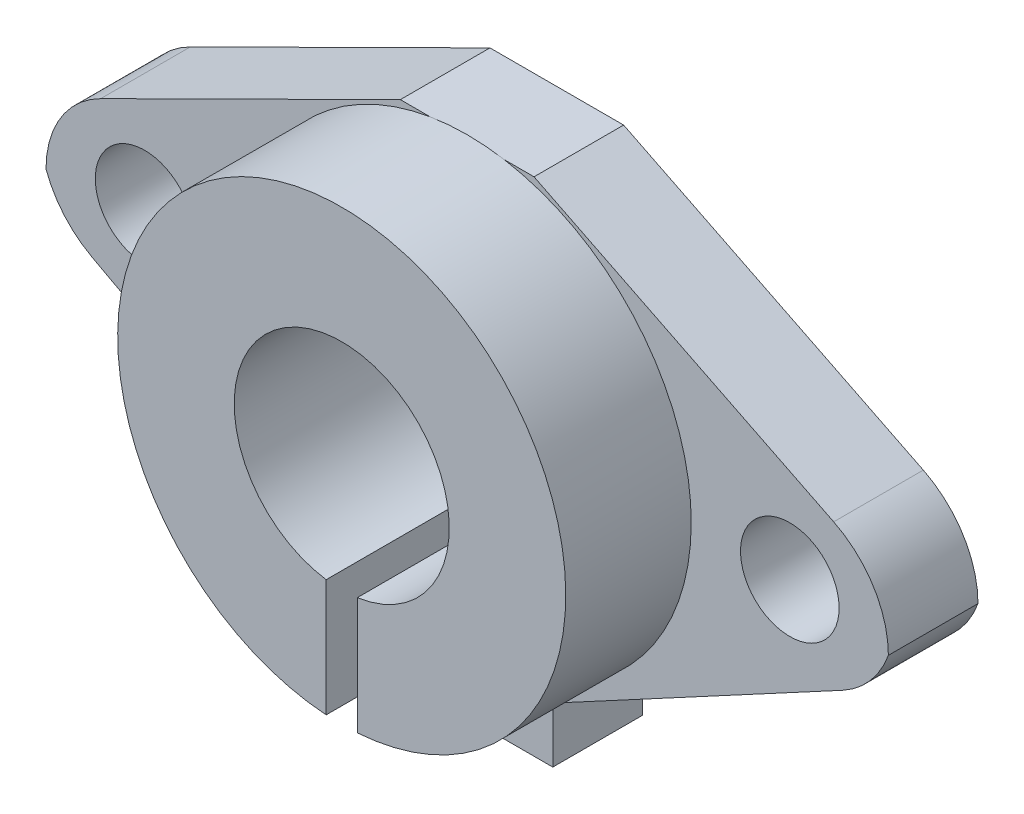
from build123d import *

# Parameters (mm, degrees)
RESSALTO_EXTRUS_O1_DEPTH   = 5
ESBO_O3_R                  = 12.5
RESSALTO_EXTRUS_O2_DEPTH   = 7
CORTE_EXTRUS_O1_DEPTH      = 30.100324457
CORTE_EXTRUS_O1_DEPTH_BACK = 30.100324457
ESBO_O2_R                  = 6
ESBO_O2_R_2                = 2.75
FILETE8_R                  = 5.5
FILETE9_R                  = 5.5
FILETE10_R                 = 5.5
FILETE11_R                 = 5.5
CORTE_EXTRUS_O2_DEPTH      = 31.689230742
CORTE_EXTRUS_O2_DEPTH_BACK = 31.689230742
ESBO_O4_W                  = 1.736979024
ESBO_O4_H                  = 15.670956688


with BuildPart() as part:
    # Ressalto-extrusão1: read off the stored shape, not the designer's step
    # Ressalto-extrusão1 outline → Ressalto-extrusão1 (new body)
    with BuildSketch(Plane.XY):
        Polygon((4.775767162, -12.578134648), (23.5, -2.5), (23.5, 2.5), (3.728917801, 12.329043312), (-3.728917801, 12.329043312), (-23.5, 2.5), (-23.5, -2.5), (-4.775767162, -12.578134648), (-4.775767162, -15.670956688), (-0.868489512, -15.670956688), (-0.868489512, 0), (0.868489512, 0), (0.868489512, -15.670956688), (4.775767162, -15.670956688), align=None)
    extrude(amount=RESSALTO_EXTRUS_O1_DEPTH)

    # Esboço3 → Ressalto-extrusão2 (add)
    with BuildSketch(Plane.XY.offset(5)):
        with Locations(Location((0, 0, 0), (0, 0, 99.486846806))):
            Circle(ESBO_O3_R)
    extrude(amount=RESSALTO_EXTRUS_O2_DEPTH)

    # Esboço2 → Corte-extrusão1 (cut, two sides: drawn at the far end of the back side and taken through both)
    with BuildSketch(Plane.XY.offset(5).offset(-CORTE_EXTRUS_O1_DEPTH_BACK)):
        Circle(ESBO_O2_R)
        with Locations((-18, 0)):
            Circle(ESBO_O2_R_2)
        with Locations((18, 0)):
            Circle(ESBO_O2_R_2)
    extrude(amount=CORTE_EXTRUS_O1_DEPTH + CORTE_EXTRUS_O1_DEPTH_BACK, mode=Mode.SUBTRACT)

    # Filete8
    filete8_edges = [part.edges().sort_by_distance(p)[0] for p in [
        (-23.5, 2.5, 2.5),
    ]]
    fillet(filete8_edges, radius=FILETE8_R)

    # Filete9
    # the kernel refuses this fillet: 5.5 mm, written as the material it takes off along each edge
    with BuildSketch(Plane(origin=(-23.5, -2.5, -7.284114841), x_dir=(1.1558918030709584e-12, 1.0, 0), z_dir=(0, 0, 1))) as filete9_piece_1:
        with BuildLine():
            CenterArc((3.462119709, -5.172336006), FILETE9_R, 109.876993247, 41.832083594)
            Line((-1.380918754, -2.565618062), (-1.477779523, -2.513483703))
            Line((-1.477779523, -2.513483703), (-0.096860769, 0.052134359))
            Line((-0.096860769, 0.052134359), (0, 0.11))
            ThreePointArc((0, 0.11), (0.796054475, 0.11), (1.554708735, 0.10344672))
            Line((1.554708735, 0.10344672), (1.592108951, 0))
        make_face()
    extrude(amount=19.568229683, mode=Mode.SUBTRACT)

    # Filete10
    filete10_edges = [part.edges().sort_by_distance(p)[0] for p in [
        (23.5, 2.5, 2.5),
    ]]
    fillet(filete10_edges, radius=FILETE10_R)

    # Filete11
    # the kernel refuses this fillet: 5.5 mm, written as the material it takes off along each edge
    with BuildSketch(Plane(origin=(23.5, -2.5, -7.284114841), x_dir=(-1.1603547057855156e-12, 1.0, 0), z_dir=(0, 0, 1))) as filete11_piece_1:
        with BuildLine():
            CenterArc((3.462119709, 5.172336006), FILETE11_R, 208.290923159, 41.832083594)
            Line((-1.380918754, 2.565618062), (-1.477779523, 2.513483703))
            Line((-1.477779523, 2.513483703), (-0.096860769, -0.052134359))
            Line((-0.096860769, -0.052134359), (0, -0.11))
            ThreePointArc((0, -0.11), (0.796054475, -0.11), (1.554708735, -0.10344672))
            Line((1.554708735, -0.10344672), (1.592108951, 0))
        make_face()
    extrude(amount=19.568229683, mode=Mode.SUBTRACT)

    # Esboço4 → Corte-extrusão2 (cut, two sides: drawn at the far end of the back side and taken through both)
    with BuildSketch(Plane.XY.offset(12).offset(-CORTE_EXTRUS_O2_DEPTH_BACK)):
        with Locations((0, -7.835478344)):
            Rectangle(ESBO_O4_W, ESBO_O4_H)
    extrude(amount=CORTE_EXTRUS_O2_DEPTH + CORTE_EXTRUS_O2_DEPTH_BACK, mode=Mode.SUBTRACT)


solid = part.part
